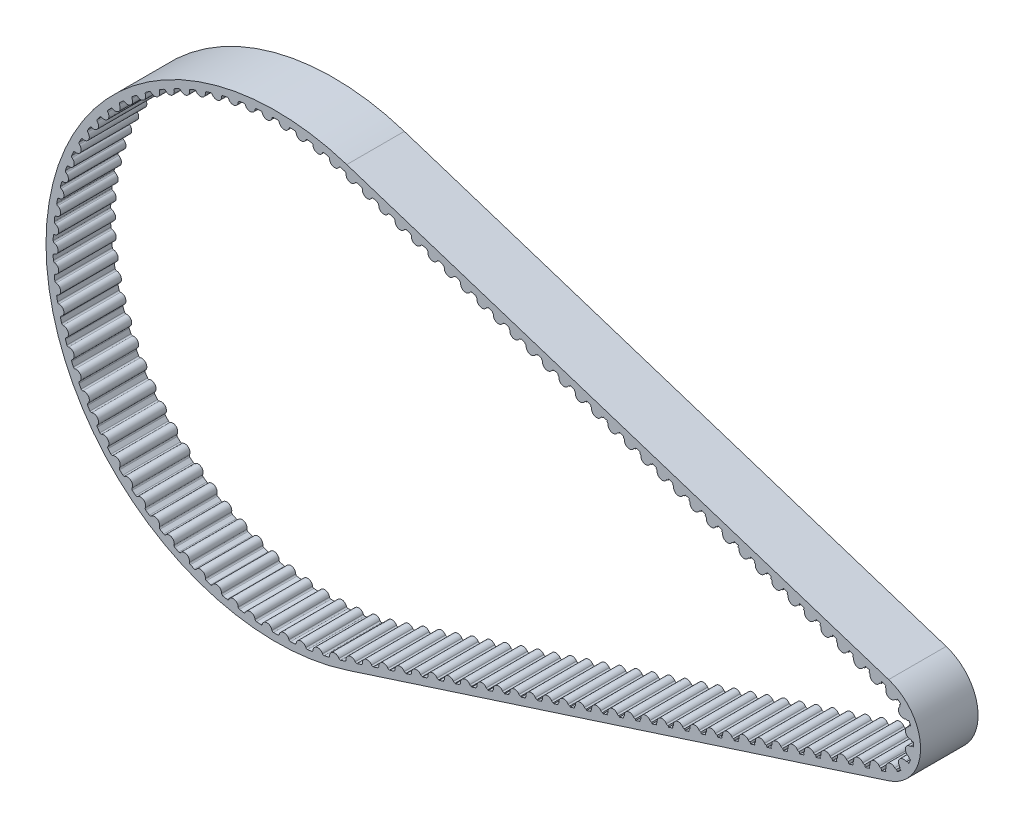
from build123d import *

# Parameters (mm, degrees)
BOSS_EXTRUDE1_DEPTH = 5
BOSS_EXTRUDE2_DEPTH = 10
CRVPATTERN1_START   = -5
CRVPATTERN1_DEPTH   = 10


# Read off the part's stored shape, not the designer's step: CrvPattern1
with BuildPart() as part:
    # Sketch1 → Boss-Extrude1 (new, symmetric)
    with BuildSketch(Plane.XY):
        with BuildLine():
            Line((12.298331989, 38.063635028), (106.512971248, 7.622955598))
            ThreePointArc((106.512971248, 7.622955598), (112.060972439, 0), (106.512971248, -7.622955598))
            Line((106.512971248, -7.622955598), (12.298331989, -38.063635028))
            ThreePointArc((12.298331989, -38.063635028), (-40.001116001, 0), (12.298331989, 38.063635028))
        make_face()
        with BuildLine():
            Line((11.920168831, 36.893210906), (106.13480809, 6.452531476))
            ThreePointArc((106.13480809, 6.452531476), (110.830972439, 0), (106.13480809, -6.452531476))
            Line((106.13480809, -6.452531476), (11.920168831, -36.893210906))
            ThreePointArc((11.920168831, -36.893210906), (-38.771116001, 0), (11.920168831, 36.893210906))
        make_face(mode=Mode.SUBTRACT)
    extrude(amount=BOSS_EXTRUDE1_DEPTH, both=True)

    # Sketch2 → Boss-Extrude2 (add)
    with BuildSketch(Plane.XY.offset(5)):
        with BuildLine():
            Line((-38.755415339, -1.103275955), (-39.255415339, -1.103275955))
            Line((-39.255415339, -1.103275955), (-39.255415339, 1.103275955))
            Line((-39.255415339, 1.103275955), (-38.755415339, 1.103275955))
            ThreePointArc((-38.755415339, 1.103275955), (-38.702819705, 0.938947145), (-38.558931953, 0.843728588))
            ThreePointArc((-38.558931953, 0.843728588), (-37.901116001, 0), (-38.558931953, -0.843728588))
            ThreePointArc((-38.558931953, -0.843728588), (-38.702819705, -0.938947145), (-38.755415339, -1.103275955))
        make_face()
    extrude(amount=-BOSS_EXTRUDE2_DEPTH)

    # CrvPattern1 outline → CrvPattern1 (add)
    with BuildSketch(Plane.XY.offset(CRVPATTERN1_START)):
        with BuildLine():
            ThreePointArc((-38.381581489, 3.789104595), (-38.517768642, 3.895044759), (-38.557647348, 4.062913599))
            ThreePointArc((-38.557647348, 4.062913599), (-38.657647934, 2.964066828), (-38.726339096, 1.862819413))
            ThreePointArc((-38.726339096, 1.862819413), (-38.661334387, 2.02264634), (-38.510588244, 2.106585955))
            ThreePointArc((-38.510588244, 2.106585955), (-37.790194087, 2.89755499), (-38.381581489, 3.789104595))
        make_face()
        with BuildLine():
            ThreePointArc((-37.979574926, 6.712302115), (-38.107264345, 6.828343792), (-38.134192704, 6.998770088))
            ThreePointArc((-38.134192704, 6.998770088), (-38.317907888, 5.9107843), (-38.470588808, 4.818011277))
            ThreePointArc((-38.470588808, 4.818011277), (-38.393555513, 4.972400817), (-38.236833329, 5.044570172))
            ThreePointArc((-38.236833329, 5.044570172), (-37.458077599, 5.778149936), (-37.979574926, 6.712302115))
        make_face()
        with BuildLine():
            ThreePointArc((-37.355265299, 9.596211007), (-37.473709589, 9.721674982), (-37.487529983, 9.893661189))
            ThreePointArc((-37.487529983, 9.893661189), (-37.753884438, 8.822904612), (-37.989661441, 7.745002228))
            ThreePointArc((-37.989661441, 7.745002228), (-37.901050453, 7.893050704), (-37.739269559, 7.953027376))
            ThreePointArc((-37.739269559, 7.953027376), (-36.906710489, 8.624924058), (-37.355265299, 9.596211007))
        make_face()
        with BuildLine():
            ThreePointArc((-36.512306833, 12.423951101), (-36.620812714, 12.558103002), (-36.621444248, 12.730642447))
            ThreePointArc((-36.621444248, 12.730642447), (-36.968878941, 11.683382461), (-37.286371971, 10.626659924))
            ThreePointArc((-37.286371971, 10.626659924), (-37.186701949, 10.767500776), (-37.020809286, 10.814933707))
            ThreePointArc((-37.020809286, 10.814933707), (-36.139320033, 11.421214544), (-36.512306833, 12.423951101))
        make_face()
        with BuildLine():
            ThreePointArc((-35.455633556, 15.178970992), (-35.553565917, 15.321025599), (-35.541004896, 15.493108369))
            ThreePointArc((-35.541004896, 15.493108369), (-35.967486213, 14.475474825), (-36.364836911, 13.446117371))
            ThreePointArc((-36.364836911, 13.446117371), (-36.254691247, 13.578926224), (-36.085657821, 13.613537779))
            ThreePointArc((-36.085657821, 13.613537779), (-35.160397942, 14.150654072), (-35.455633556, 15.178970992))
        make_face()
        with BuildLine():
            ThreePointArc((-34.191430416, 17.845144924), (-34.278216037, 17.994270759), (-34.252535983, 18.164889613))
            ThreePointArc((-34.252535983, 18.164889613), (-34.755567633, 17.182838951), (-35.230450214, 16.186871644))
            ThreePointArc((-35.230450214, 16.186871644), (-35.110473616, 16.310871138), (-34.939288819, 16.332458727))
            ThreePointArc((-34.939288819, 16.332458727), (-33.975674069, 16.797266612), (-34.191430416, 17.845144924))
        make_face()
        with BuildLine():
            ThreePointArc((-32.727097081, 20.406867175), (-32.802227986, 20.562191371), (-32.76357921, 20.73034764))
            ThreePointArc((-32.76357921, 20.73034764), (-33.340216834, 19.789628025), (-33.889851704, 18.832880486))
            ThreePointArc((-33.889851704, 18.832880486), (-33.760746421, 18.947344824), (-33.588412237, 18.955782091))
            ThreePointArc((-33.588412237, 18.955782091), (-32.592082872, 19.345560942), (-32.727097081, 20.406867175))
        make_face()
        with BuildLine():
            ThreePointArc((-31.071204625, 22.849143406), (-31.134241056, 23.009756815), (-31.082849778, 23.174466242))
            ThreePointArc((-31.082849778, 23.174466242), (-31.729718185, 22.280583919), (-32.350888206, 21.368656209))
            ThreePointArc((-32.350888206, 21.368656209), (-32.213409922, 21.472915405), (-32.040935061, 21.468152964))
            ThreePointArc((-32.040935061, 21.468152964), (-31.017722823, 21.780621318), (-31.071204625, 22.849143406))
        make_face()
        with BuildLine():
            ThreePointArc((-29.233445363, 25.157678419), (-29.284018353, 25.322640934), (-29.220185379, 25.482939438))
            ThreePointArc((-29.220185379, 25.482939438), (-29.933498302, 24.641126503), (-30.622567625, 23.779356341))
            ThreePointArc((-30.622567625, 23.779356341), (-30.477521031, 23.872800143), (-30.305915027, 23.85486587))
            ThreePointArc((-30.305915027, 23.85486587), (-29.261809009, 24.088194777), (-29.233445363, 25.157678419))
        make_face()
        with BuildLine():
            ThreePointArc((-27.224576117, 27.318959836), (-27.262389651, 27.487305894), (-27.186488608, 27.64225521))
            ThreePointArc((-27.186488608, 27.64225521), (-27.962070865, 26.857438985), (-28.715006211, 26.050870508))
            ThreePointArc((-28.715006211, 26.050870508), (-28.563240297, 26.132951968), (-28.3935076, 26.101950836))
            ThreePointArc((-28.3935076, 26.101950836), (-27.334619191, 26.254774571), (-27.224576117, 27.318959836))
        make_face()
        with BuildLine():
            ThreePointArc((-25.056355252, 29.320337186), (-25.081188, 29.49108142), (-24.993663155, 29.639774595))
            ThreePointArc((-24.993663155, 29.639774595), (-25.826975086, 28.916548787), (-26.639369354, 28.169903023))
            ThreePointArc((-26.639369354, 28.169903023), (-26.481772441, 28.240141699), (-26.314906534, 28.196255165))
            ThreePointArc((-26.314906534, 28.196255165), (-25.247433649, 28.267679216), (-25.056355252, 29.320337186))
        make_face()
        with BuildLine():
            ThreePointArc((-22.741473859, 31.150095954), (-22.753180468, 31.322238959), (-22.654544124, 31.463805658))
            ThreePointArc((-22.654544124, 31.463805658), (-23.540708166, 30.806403473), (-24.407806228, 30.124050708))
            ThreePointArc((-24.407806228, 30.124050708), (-24.245300766, 30.182035478), (-24.082278354, 30.125520419))
            ThreePointArc((-24.082278354, 30.125520419), (-23.012469152, 30.115126724), (-22.741473859, 31.150095954))
        make_face()
        with BuildLine():
            ThreePointArc((-20.293481463, 32.797526147), (-20.291993412, 32.970060331), (-20.182822909, 33.103671932))
            ThreePointArc((-20.182822909, 33.103671932), (-21.116652144, 32.515941292), (-22.033378678, 31.901875492))
            ThreePointArc((-22.033378678, 31.901875492), (-21.866915848, 31.947266959), (-21.708691137, 31.878454171))
            ThreePointArc((-21.708691137, 31.878454171), (-20.642807456, 31.786303567), (-20.293481463, 32.797526147))
        make_face()
        with BuildLine():
            ThreePointArc((-17.726706718, 34.252984982), (-17.712032717, 34.424900463), (-17.592967055, 34.549774907))
            ThreePointArc((-17.592967055, 34.549774907), (-18.568995567, 34.035155935), (-19.529984765, 33.492971367))
            ThreePointArc((-19.529984765, 33.492971367), (-19.360538913, 33.525503841), (-19.208038029, 33.444796102))
            ThreePointArc((-19.208038029, 33.444796102), (-18.152318726, 33.271427967), (-17.726706718, 34.252984982))
        make_face()
        with BuildLine():
            ThreePointArc((-15.056173539, 35.507953329), (-15.028399478, 35.678243847), (-14.900135575, 35.793650216))
            ThreePointArc((-14.900135575, 35.793650216), (-15.912650449, 35.355155092), (-16.912277424, 34.888025284))
            ThreePointArc((-16.912277424, 34.888025284), (-16.740840354, 34.907508348), (-16.594955919, 34.815378058))
            ThreePointArc((-16.594955919, 34.815378058), (-15.555580359, 34.561807154), (-15.056173539, 35.507953329))
        make_face()
        with BuildLine():
            ThreePointArc((-12.297513162, 36.555085574), (-12.256801609, 36.722754379), (-12.120090224, 36.828017173))
            ThreePointArc((-12.120090224, 36.828017173), (-13.16316498, 36.468212509), (-14.195578687, 36.078871679))
            ThreePointArc((-14.195578687, 36.078871679), (-14.023153859, 36.085191293), (-13.884739768, 35.982177711))
            ThreePointArc((-13.884739768, 35.982177711), (-12.867791653, 35.649888248), (-12.297513162, 36.555085574))
        make_face()
        with BuildLine():
            ThreePointArc((-9.466872652, 37.388252613), (-9.4134619, 37.552318302), (-9.269103235, 37.646821395))
            ThreePointArc((-9.269103235, 37.646821395), (-10.336632521, 37.367813209), (-11.39579001, 37.058540257))
            ThreePointArc((-11.39579001, 37.058540257), (-11.223386666, 37.051659431), (-11.093253087, 36.938365519))
            ThreePointArc((-11.093253087, 36.938365519), (-10.104684844, 36.529302461), (-9.466872652, 37.388252613))
        make_face()
        with BuildLine():
            ThreePointArc((-6.580820389, 38.002577732), (-6.515023065, 38.162079992), (-6.363862084, 38.245270234))
            ThreePointArc((-6.363862084, 38.245270234), (-7.449597408, 38.048691625), (-8.529299189, 37.821296795))
            ThreePointArc((-8.529299189, 37.821296795), (-8.357926445, 37.801255804), (-8.236835081, 37.678344697))
            ThreePointArc((-8.236835081, 37.678344697), (-7.282433024, 37.194902384), (-6.580820389, 38.002577732))
        make_face()
        with BuildLine():
            ThreePointArc((-3.656249093, 38.394465146), (-3.578450323, 38.548470373), (-3.421371805, 38.619860835))
            ThreePointArc((-3.421371805, 38.619860835), (-4.518958112, 38.506862421), (-5.612884446, 38.362676707))
            ThreePointArc((-5.612884446, 38.362676707), (-5.443545386, 38.329592855), (-5.332205011, 38.19778398))
            ThreePointArc((-5.332205011, 38.19778398), (-4.417555472, 37.642792109), (-3.656249093, 38.394465146))
        make_face()
        with BuildLine():
            ThreePointArc((-0.710276942, 38.561621049), (-0.620932099, 38.709227817), (-0.458855461, 38.768400632))
            ThreePointArc((-0.458855461, 38.768400632), (-1.56186833, 38.739643819), (-2.663616218, 38.679511172))
            ThreePointArc((-2.663616218, 38.679511172), (-2.497302021, 38.633578108), (-2.396364336, 38.493642972))
            ThreePointArc((-2.396364336, 38.493642972), (-1.526820966, 37.870350036), (-0.710276942, 38.561621049))
        make_face()
        with BuildLine():
            ThreePointArc((2.239852622, 38.50306704), (2.340220581, 38.643411372), (2.506346668, 38.69002019))
            ThreePointArc((2.506346668, 38.69002019), (1.404363422, 38.745673298), (0.30124276, 38.769945689))
            ThreePointArc((0.30124276, 38.769945689), (0.463558619, 38.711432268), (0.553502803, 38.564189942))
            ThreePointArc((0.553502803, 38.564189942), (1.37285037, 37.876244217), (2.239852622, 38.50306704))
        make_face()
        with BuildLine():
            ThreePointArc((5.17687182, 38.219145849), (5.28767542, 38.351406278), (5.456878582, 38.385178286))
            ThreePointArc((5.456878582, 38.385178286), (4.362375116, 38.524915565), (3.264338495, 38.633450921))
            ThreePointArc((3.264338495, 38.633450921), (3.421705945, 38.562699636), (3.500130165, 38.409011964))
            ThreePointArc((3.500130165, 38.409011964), (4.264486101, 37.660440151), (5.17687182, 38.219145849))
        make_face()
        with BuildLine():
            ThreePointArc((8.083589613, 37.711519331), (8.204180295, 37.834921706), (8.375470148, 37.85565923))
            ThreePointArc((8.375470148, 37.85565923), (7.29485284, 38.078662765), (6.208327318, 38.270825805))
            ThreePointArc((6.208327318, 38.270825805), (6.359825251, 38.18825078), (6.426270471, 38.02901733))
            ThreePointArc((6.426270471, 38.02901733), (7.131160828, 37.22420099), (8.083589613, 37.711519331))
        make_face()
        with BuildLine():
            ThreePointArc((10.942992324, 36.983158738), (11.072664242, 37.096980759), (11.245038188, 37.104562416))
            ThreePointArc((11.245038188, 37.104562416), (10.184632135, 37.409526917), (9.115977392, 37.684192868))
            ThreePointArc((9.115977392, 37.684192868), (9.260719057, 37.590277431), (9.314796359, 37.426430234))
            ThreePointArc((9.314796359, 37.426430234), (9.956095253, 36.570080139), (10.942992324, 36.983158738))
        make_face()
        with BuildLine():
            Line((14.071899965, 36.172361246), (14.079489261, 36.195536092))
            Line((14.079489261, 36.195536092), (11.979796702, 36.873945186))
            Line((11.979796702, 36.873945186), (11.974927814, 36.859077439))
            ThreePointArc((11.974927814, 36.859077439), (12.114727229, 36.757951862), (12.160436832, 36.59157611))
            ThreePointArc((12.160436832, 36.59157611), (12.757541517, 35.703845435), (13.764093055, 36.066410958))
            ThreePointArc((13.764093055, 36.066410958), (13.899363252, 36.173519467), (14.071899965, 36.172361246))
        make_face()
        with BuildLine():
            Line((16.919227329, 35.239918816), (16.93051047, 35.274373273))
            Line((16.93051047, 35.274373273), (14.830817911, 35.952782367))
            Line((14.830817911, 35.952782367), (14.822255178, 35.926635009))
            ThreePointArc((14.822255178, 35.926635009), (14.962054592, 35.825509432), (15.007764196, 35.65913368))
            ThreePointArc((15.007764196, 35.65913368), (15.604868881, 34.771403005), (16.611420419, 35.133968528))
            ThreePointArc((16.611420419, 35.133968528), (16.746690616, 35.241077037), (16.919227329, 35.239918816))
        make_face()
        with BuildLine():
            Line((19.766554693, 34.307476386), (19.78153168, 34.353210454))
            Line((19.78153168, 34.353210454), (17.681839121, 35.031619548))
            Line((17.681839121, 35.031619548), (17.669582542, 34.994192579))
            ThreePointArc((17.669582542, 34.994192579), (17.809381956, 34.893067002), (17.85509156, 34.72669125))
            ThreePointArc((17.85509156, 34.72669125), (18.452196245, 33.838960575), (19.458747783, 34.201526098))
            ThreePointArc((19.458747783, 34.201526098), (19.59401798, 34.308634606), (19.766554693, 34.307476386))
        make_face()
        with BuildLine():
            Line((22.613882057, 33.375033955), (22.63255289, 33.432047635))
            Line((22.63255289, 33.432047635), (20.532860331, 34.110456729))
            Line((20.532860331, 34.110456729), (20.516909905, 34.061750149))
            ThreePointArc((20.516909905, 34.061750149), (20.65670932, 33.960624571), (20.702418924, 33.794248819))
            ThreePointArc((20.702418924, 33.794248819), (21.29952361, 32.906518145), (22.306075147, 33.269083668))
            ThreePointArc((22.306075147, 33.269083668), (22.441345344, 33.376192176), (22.613882057, 33.375033955))
        make_face()
        with BuildLine():
            Line((25.461209421, 32.442591525), (25.483574099, 32.510884816))
            Line((25.483574099, 32.510884816), (23.38388154, 33.18929391))
            Line((23.38388154, 33.18929391), (23.364237269, 33.129307719))
            ThreePointArc((23.364237269, 33.129307719), (23.504036684, 33.028182141), (23.549746287, 32.861806389))
            ThreePointArc((23.549746287, 32.861806389), (24.146850973, 31.974075714), (25.153402511, 32.336641238))
            ThreePointArc((25.153402511, 32.336641238), (25.288672708, 32.443749746), (25.461209421, 32.442591525))
        make_face()
        with BuildLine():
            Line((28.308536784, 31.510149095), (28.334595309, 31.589721997))
            Line((28.334595309, 31.589721997), (26.23490275, 32.268131091))
            Line((26.23490275, 32.268131091), (26.211564633, 32.196865288))
            ThreePointArc((26.211564633, 32.196865288), (26.351364048, 32.095739711), (26.397073651, 31.929363959))
            ThreePointArc((26.397073651, 31.929363959), (26.994178337, 31.041633284), (28.000729875, 31.404198808))
            ThreePointArc((28.000729875, 31.404198808), (28.136000072, 31.511307316), (28.308536784, 31.510149095))
        make_face()
        with BuildLine():
            Line((31.155864148, 30.577706665), (31.185616518, 30.668559178))
            Line((31.185616518, 30.668559178), (29.085923959, 31.346968272))
            Line((29.085923959, 31.346968272), (29.058891997, 31.264422858))
            ThreePointArc((29.058891997, 31.264422858), (29.198691412, 31.163297281), (29.244401015, 30.996921529))
            ThreePointArc((29.244401015, 30.996921529), (29.841505701, 30.109190854), (30.848057239, 30.471756377))
            ThreePointArc((30.848057239, 30.471756377), (30.983327435, 30.578864886), (31.155864148, 30.577706665))
        make_face()
        with BuildLine():
            Line((34.003191512, 29.645264235), (34.036637728, 29.747396359))
            Line((34.036637728, 29.747396359), (31.936945169, 30.425805453))
            Line((31.936945169, 30.425805453), (31.906219361, 30.331980428))
            ThreePointArc((31.906219361, 30.331980428), (32.046018776, 30.230854851), (32.091728379, 30.064479099))
            ThreePointArc((32.091728379, 30.064479099), (32.688833064, 29.176748424), (33.695384602, 29.539313947))
            ThreePointArc((33.695384602, 29.539313947), (33.830654799, 29.646422456), (34.003191512, 29.645264235))
        make_face()
        with BuildLine():
            Line((36.850518876, 28.712821805), (36.887658938, 28.82623354))
            Line((36.887658938, 28.82623354), (34.787966379, 29.504642634))
            Line((34.787966379, 29.504642634), (34.753546725, 29.399537998))
            ThreePointArc((34.753546725, 29.399537998), (34.89334614, 29.29841242), (34.939055743, 29.132036668))
            ThreePointArc((34.939055743, 29.132036668), (35.536160429, 28.244305994), (36.542711966, 28.606871517))
            ThreePointArc((36.542711966, 28.606871517), (36.677982163, 28.713980025), (36.850518876, 28.712821805))
        make_face()
        with BuildLine():
            Line((39.69784624, 27.780379374), (39.738680147, 27.905070721))
            Line((39.738680147, 27.905070721), (37.638987588, 28.583479815))
            Line((37.638987588, 28.583479815), (37.600874089, 28.467095568))
            ThreePointArc((37.600874089, 28.467095568), (37.740673503, 28.36596999), (37.786383107, 28.199594238))
            ThreePointArc((37.786383107, 28.199594238), (38.383487793, 27.311863564), (39.39003933, 27.674429087))
            ThreePointArc((39.39003933, 27.674429087), (39.525309527, 27.781537595), (39.69784624, 27.780379374))
        make_face()
        with BuildLine():
            Line((42.545173604, 26.847936944), (42.589701357, 26.983907902))
            Line((42.589701357, 26.983907902), (40.490008798, 27.662316996))
            Line((40.490008798, 27.662316996), (40.448201453, 27.534653138))
            ThreePointArc((40.448201453, 27.534653138), (40.588000867, 27.43352756), (40.633710471, 27.267151808))
            ThreePointArc((40.633710471, 27.267151808), (41.230815156, 26.379421133), (42.237366694, 26.741986657))
            ThreePointArc((42.237366694, 26.741986657), (42.372636891, 26.849095165), (42.545173604, 26.847936944))
        make_face()
        with BuildLine():
            Line((45.392500968, 25.915494514), (45.440722566, 26.062745083))
            Line((45.440722566, 26.062745083), (43.341030007, 26.741154177))
            Line((43.341030007, 26.741154177), (43.295528816, 26.602210707))
            ThreePointArc((43.295528816, 26.602210707), (43.435328231, 26.50108513), (43.481037834, 26.334709378))
            ThreePointArc((43.481037834, 26.334709378), (44.07814252, 25.446978703), (45.084694058, 25.809544227))
            ThreePointArc((45.084694058, 25.809544227), (45.219964255, 25.916652735), (45.392500968, 25.915494514))
        make_face()
        with BuildLine():
            Line((48.239828331, 24.983052084), (48.291743776, 25.141582264))
            Line((48.291743776, 25.141582264), (46.192051217, 25.819991358))
            Line((46.192051217, 25.819991358), (46.14285618, 25.669768277))
            ThreePointArc((46.14285618, 25.669768277), (46.282655595, 25.5686427), (46.328365198, 25.402266948))
            ThreePointArc((46.328365198, 25.402266948), (46.925469884, 24.514536273), (47.932021422, 24.877101796))
            ThreePointArc((47.932021422, 24.877101796), (48.067291618, 24.984210305), (48.239828331, 24.983052084))
        make_face()
        with BuildLine():
            Line((51.087155695, 24.050609654), (51.142764986, 24.220419445))
            Line((51.142764986, 24.220419445), (49.043072427, 24.898828539))
            Line((49.043072427, 24.898828539), (48.990183544, 24.737325847))
            ThreePointArc((48.990183544, 24.737325847), (49.129982959, 24.63620027), (49.175692562, 24.469824518))
            ThreePointArc((49.175692562, 24.469824518), (49.772797248, 23.582093843), (50.779348786, 23.944659366))
            ThreePointArc((50.779348786, 23.944659366), (50.914618982, 24.051767875), (51.087155695, 24.050609654))
        make_face()
        with BuildLine():
            Line((53.934483059, 23.118167223), (53.993786195, 23.299256626))
            Line((53.993786195, 23.299256626), (51.894093636, 23.97766572))
            Line((51.894093636, 23.97766572), (51.837510908, 23.804883417))
            ThreePointArc((51.837510908, 23.804883417), (51.977310323, 23.70375784), (52.023019926, 23.537382087))
            ThreePointArc((52.023019926, 23.537382087), (52.620124612, 22.649651413), (53.626676149, 23.012216936))
            ThreePointArc((53.626676149, 23.012216936), (53.761946346, 23.119325444), (53.934483059, 23.118167223))
        make_face()
        with BuildLine():
            Line((56.781810423, 22.185724793), (56.844807405, 22.378093807))
            Line((56.844807405, 22.378093807), (54.745114846, 23.056502901))
            Line((54.745114846, 23.056502901), (54.684838272, 22.872440987))
            ThreePointArc((54.684838272, 22.872440987), (54.824637686, 22.771315409), (54.87034729, 22.604939657))
            ThreePointArc((54.87034729, 22.604939657), (55.467451976, 21.717208983), (56.474003513, 22.079774506))
            ThreePointArc((56.474003513, 22.079774506), (56.60927371, 22.186883014), (56.781810423, 22.185724793))
        make_face()
        with BuildLine():
            Line((59.629137787, 21.253282363), (59.695828614, 21.456930988))
            Line((59.695828614, 21.456930988), (57.596136055, 22.135340082))
            Line((57.596136055, 22.135340082), (57.532165636, 21.939998557))
            ThreePointArc((57.532165636, 21.939998557), (57.67196505, 21.838872979), (57.717674654, 21.672497227))
            ThreePointArc((57.717674654, 21.672497227), (58.31477934, 20.784766552), (59.321330877, 21.147332076))
            ThreePointArc((59.321330877, 21.147332076), (59.456601074, 21.254440584), (59.629137787, 21.253282363))
        make_face()
        with BuildLine():
            Line((62.476465151, 20.320839933), (62.546849824, 20.535768169))
            Line((62.546849824, 20.535768169), (60.447157265, 21.214177263))
            Line((60.447157265, 21.214177263), (60.379493, 21.007556126))
            ThreePointArc((60.379493, 21.007556126), (60.519292414, 20.906430549), (60.565002018, 20.740054797))
            ThreePointArc((60.565002018, 20.740054797), (61.162106703, 19.852324122), (62.168658241, 20.214889646))
            ThreePointArc((62.168658241, 20.214889646), (62.303928438, 20.321998154), (62.476465151, 20.320839933))
        make_face()
        with BuildLine():
            Line((65.323792515, 19.388397503), (65.397871034, 19.61460535))
            Line((65.397871034, 19.61460535), (63.298178475, 20.293014444))
            Line((63.298178475, 20.293014444), (63.226820363, 20.075113696))
            ThreePointArc((63.226820363, 20.075113696), (63.366619778, 19.973988119), (63.412329382, 19.807612367))
            ThreePointArc((63.412329382, 19.807612367), (64.009434067, 18.919881692), (65.015985605, 19.282447215))
            ThreePointArc((65.015985605, 19.282447215), (65.151255802, 19.389555724), (65.323792515, 19.388397503))
        make_face()
        with BuildLine():
            Line((68.171119878, 18.455955073), (68.248892243, 18.693442531))
            Line((68.248892243, 18.693442531), (66.149199684, 19.371851625))
            Line((66.149199684, 19.371851625), (66.074147727, 19.142671266))
            ThreePointArc((66.074147727, 19.142671266), (66.213947142, 19.041545689), (66.259656745, 18.875169937))
            ThreePointArc((66.259656745, 18.875169937), (66.856761431, 17.987439262), (67.863312969, 18.350004785))
            ThreePointArc((67.863312969, 18.350004785), (67.998583165, 18.457113294), (68.171119878, 18.455955073))
        make_face()
        with BuildLine():
            Line((71.018447242, 17.523512642), (71.099913453, 17.772279712))
            Line((71.099913453, 17.772279712), (69.000220894, 18.450688806))
            Line((69.000220894, 18.450688806), (68.921475091, 18.210228836))
            ThreePointArc((68.921475091, 18.210228836), (69.061274506, 18.109103258), (69.106984109, 17.942727506))
            ThreePointArc((69.106984109, 17.942727506), (69.704088795, 17.054996832), (70.710640333, 17.417562355))
            ThreePointArc((70.710640333, 17.417562355), (70.84591053, 17.524670863), (71.018447242, 17.523512642))
        make_face()
        with BuildLine():
            Line((73.865774606, 16.591070212), (73.950934662, 16.851116893))
            Line((73.950934662, 16.851116893), (71.851242103, 17.529525987))
            Line((71.851242103, 17.529525987), (71.768802455, 17.277786406))
            ThreePointArc((71.768802455, 17.277786406), (71.90860187, 17.176660828), (71.954311473, 17.010285076))
            ThreePointArc((71.954311473, 17.010285076), (72.551416159, 16.122554402), (73.557967697, 16.485119925))
            ThreePointArc((73.557967697, 16.485119925), (73.693237894, 16.592228433), (73.865774606, 16.591070212))
        make_face()
        with BuildLine():
            Line((76.71310197, 15.658627782), (76.801955872, 15.929954074))
            Line((76.801955872, 15.929954074), (74.702263313, 16.608363168))
            Line((74.702263313, 16.608363168), (74.616129819, 16.345343975))
            ThreePointArc((74.616129819, 16.345343975), (74.755929234, 16.244218398), (74.801638837, 16.077842646))
            ThreePointArc((74.801638837, 16.077842646), (75.398743523, 15.190111971), (76.40529506, 15.552677495))
            ThreePointArc((76.40529506, 15.552677495), (76.540565257, 15.659786003), (76.71310197, 15.658627782))
        make_face()
        with BuildLine():
            Line((79.560429334, 14.726185352), (79.652977082, 15.008791255))
            Line((79.652977082, 15.008791255), (77.553284523, 15.687200349))
            Line((77.553284523, 15.687200349), (77.463457183, 15.412901545))
            ThreePointArc((77.463457183, 15.412901545), (77.603256597, 15.311775968), (77.648966201, 15.145400216))
            ThreePointArc((77.648966201, 15.145400216), (78.246070886, 14.257669541), (79.252622424, 14.620235064))
            ThreePointArc((79.252622424, 14.620235064), (79.387892621, 14.727343573), (79.560429334, 14.726185352))
        make_face()
        with BuildLine():
            Line((82.407756698, 13.793742922), (82.503998291, 14.087628436))
            Line((82.503998291, 14.087628436), (80.404305732, 14.76603753))
            Line((80.404305732, 14.76603753), (80.310784547, 14.480459115))
            ThreePointArc((80.310784547, 14.480459115), (80.450583961, 14.379333538), (80.496293565, 14.212957786))
            ThreePointArc((80.496293565, 14.212957786), (81.09339825, 13.325227111), (82.099949788, 13.687792634))
            ThreePointArc((82.099949788, 13.687792634), (82.235219985, 13.794901143), (82.407756698, 13.793742922))
        make_face()
        with BuildLine():
            Line((85.255084062, 12.861300492), (85.355019501, 13.166465617))
            Line((85.355019501, 13.166465617), (83.255326942, 13.844874711))
            Line((83.255326942, 13.844874711), (83.15811191, 13.548016685))
            ThreePointArc((83.15811191, 13.548016685), (83.297911325, 13.446891108), (83.343620929, 13.280515356))
            ThreePointArc((83.343620929, 13.280515356), (83.940725614, 12.392784681), (84.947277152, 12.755350204))
            ThreePointArc((84.947277152, 12.755350204), (85.082547349, 12.862458712), (85.255084062, 12.861300492))
        make_face()
        with BuildLine():
            Line((88.102411425, 11.928858061), (88.20604071, 12.245302798))
            Line((88.20604071, 12.245302798), (86.106348151, 12.923711892))
            Line((86.106348151, 12.923711892), (86.005439274, 12.615574255))
            ThreePointArc((86.005439274, 12.615574255), (86.145238689, 12.514448677), (86.190948292, 12.348072925))
            ThreePointArc((86.190948292, 12.348072925), (86.788052978, 11.460342251), (87.794604516, 11.822907774))
            ThreePointArc((87.794604516, 11.822907774), (87.929874713, 11.930016282), (88.102411425, 11.928858061))
        make_face()
        with BuildLine():
            Line((90.949738789, 10.996415631), (91.05706192, 11.324139979))
            Line((91.05706192, 11.324139979), (88.957369361, 12.002549073))
            Line((88.957369361, 12.002549073), (88.852766638, 11.683131825))
            ThreePointArc((88.852766638, 11.683131825), (88.992566053, 11.582006247), (89.038275656, 11.415630495))
            ThreePointArc((89.038275656, 11.415630495), (89.635380342, 10.52789982), (90.64193188, 10.890465344))
            ThreePointArc((90.64193188, 10.890465344), (90.777202077, 10.997573852), (90.949738789, 10.996415631))
        make_face()
        with BuildLine():
            Line((93.797066153, 10.063973201), (93.90808313, 10.40297716))
            Line((93.90808313, 10.40297716), (91.808390571, 11.081386254))
            Line((91.808390571, 11.081386254), (91.700094002, 10.750689394))
            ThreePointArc((91.700094002, 10.750689394), (91.839893417, 10.649563817), (91.88560302, 10.483188065))
            ThreePointArc((91.88560302, 10.483188065), (92.482707706, 9.59545739), (93.489259244, 9.958022914))
            ThreePointArc((93.489259244, 9.958022914), (93.624529441, 10.065131422), (93.797066153, 10.063973201))
        make_face()
        with BuildLine():
            Line((96.644393517, 9.131530771), (96.759104339, 9.481814341))
            Line((96.759104339, 9.481814341), (94.65941178, 10.160223435))
            Line((94.65941178, 10.160223435), (94.547421366, 9.818246964))
            ThreePointArc((94.547421366, 9.818246964), (94.687220781, 9.717121387), (94.732930384, 9.550745635))
            ThreePointArc((94.732930384, 9.550745635), (95.330035069, 8.66301496), (96.336586607, 9.025580483))
            ThreePointArc((96.336586607, 9.025580483), (96.471856804, 9.132688992), (96.644393517, 9.131530771))
        make_face()
        with BuildLine():
            Line((99.491720881, 8.199088341), (99.610125549, 8.560651522))
            Line((99.610125549, 8.560651522), (97.51043299, 9.239060616))
            Line((97.51043299, 9.239060616), (97.39474873, 8.885804534))
            ThreePointArc((97.39474873, 8.885804534), (97.534548144, 8.784678957), (97.580257748, 8.618303205))
            ThreePointArc((97.580257748, 8.618303205), (98.177362433, 7.73057253), (99.183913971, 8.093138053))
            ThreePointArc((99.183913971, 8.093138053), (99.319184168, 8.200246562), (99.491720881, 8.199088341))
        make_face()
        with BuildLine():
            Line((102.339048245, 7.266645911), (102.461146759, 7.639488703))
            Line((102.461146759, 7.639488703), (100.3614542, 8.317897797))
            Line((100.3614542, 8.317897797), (100.242076094, 7.953362104))
            ThreePointArc((100.242076094, 7.953362104), (100.381875509, 7.852236526), (100.427585112, 7.685860774))
            ThreePointArc((100.427585112, 7.685860774), (101.024689798, 6.7981301), (102.031241335, 7.160695623))
            ThreePointArc((102.031241335, 7.160695623), (102.166511532, 7.267804131), (102.339048245, 7.266645911))
        make_face()
        with BuildLine():
            Line((105.186375609, 6.33420348), (105.312167968, 6.718325884))
            Line((105.312167968, 6.718325884), (103.212475409, 7.396734978))
            Line((103.212475409, 7.396734978), (103.089403457, 7.020919674))
            ThreePointArc((103.089403457, 7.020919674), (103.229202872, 6.919794096), (103.274912476, 6.753418344))
            ThreePointArc((103.274912476, 6.753418344), (103.872017162, 5.86568767), (104.878568699, 6.228253193))
            ThreePointArc((104.878568699, 6.228253193), (105.013838896, 6.335361701), (105.186375609, 6.33420348))
        make_face()
        with BuildLine():
            Line((107.890949372, 5.204158934), (108.033072459, 5.487870352))
            ThreePointArc((108.033072459, 5.487870352), (107.122041074, 6.045175834), (106.13480809, 6.452531476))
            Line((106.13480809, 6.452531476), (106.06042124, 6.476565812))
            Line((106.06042124, 6.476565812), (105.918093616, 6.192446086))
            ThreePointArc((105.918093616, 6.192446086), (106.041461413, 6.071820031), (106.062149828, 5.90052424))
            ThreePointArc((106.062149828, 5.90052424), (106.521891447, 4.934482108), (107.57088823, 5.144733162))
            ThreePointArc((107.57088823, 5.144733162), (107.720467713, 5.230734539), (107.890949372, 5.204158934))
        make_face()
        with BuildLine():
            Line((109.7496028, 3.05788983), (109.999533735, 3.253403688))
            ThreePointArc((109.999533735, 3.253403688), (109.390923568, 4.178052496), (108.639980987, 4.991358709))
            Line((108.639980987, 4.991358709), (108.390050051, 4.795844852))
            ThreePointArc((108.390050051, 4.795844852), (108.449874086, 4.634007453), (108.39521152, 4.470354581))
            ThreePointArc((108.39521152, 4.470354581), (108.396951331, 3.400496306), (109.434927391, 3.141256155))
            ThreePointArc((109.434927391, 3.141256155), (109.606926559, 3.154914306), (109.7496028, 3.05788983))
        make_face()
        with BuildLine():
            Line((110.510046967, 0.322421261), (110.819628629, 0.392065611))
            ThreePointArc((110.819628629, 0.392065611), (110.665635601, 1.488271752), (110.335339848, 2.544816342))
            Line((110.335339848, 2.544816342), (110.025758186, 2.475171992))
            ThreePointArc((110.025758186, 2.475171992), (110.010511461, 2.303306358), (109.891030391, 2.178829322))
            ThreePointArc((109.891030391, 2.178829322), (109.434433164, 1.211297033), (110.26138949, 0.532516515))
            ThreePointArc((110.26138949, 0.532516515), (110.422667246, 0.471199764), (110.510046967, 0.322421261))
        make_face()
        with BuildLine():
            Line((110.025758186, -2.475171992), (110.335339848, -2.544816342))
            ThreePointArc((110.335339848, -2.544816342), (110.665635601, -1.488271752), (110.819628629, -0.392065611))
            Line((110.819628629, -0.392065611), (110.510046967, -0.322421261))
            ThreePointArc((110.510046967, -0.322421261), (110.422667246, -0.471199764), (110.26138949, -0.532516515))
            ThreePointArc((110.26138949, -0.532516515), (109.434433164, -1.211297033), (109.891030391, -2.178829322))
            ThreePointArc((109.891030391, -2.178829322), (110.010511461, -2.303306358), (110.025758186, -2.475171992))
        make_face()
        with BuildLine():
            Line((108.390050051, -4.795844852), (108.639980987, -4.991358709))
            ThreePointArc((108.639980987, -4.991358709), (109.390923568, -4.178052496), (109.999533735, -3.253403688))
            Line((109.999533735, -3.253403688), (109.7496028, -3.05788983))
            ThreePointArc((109.7496028, -3.05788983), (109.606926559, -3.154914306), (109.434927391, -3.141256155))
            ThreePointArc((109.434927391, -3.141256155), (108.396951331, -3.400496306), (108.39521152, -4.470354581))
            ThreePointArc((108.39521152, -4.470354581), (108.449874086, -4.634007453), (108.390050051, -4.795844852))
        make_face()
        with BuildLine():
            Line((105.918093616, -6.192446086), (106.06042124, -6.476565811))
            Line((106.06042124, -6.476565811), (106.13480809, -6.452531476))
            ThreePointArc((106.13480809, -6.452531476), (107.122041074, -6.045175834), (108.033072459, -5.487870352))
            Line((108.033072459, -5.487870352), (107.890949372, -5.204158934))
            ThreePointArc((107.890949372, -5.204158934), (107.720467713, -5.230734539), (107.57088823, -5.144733162))
            ThreePointArc((107.57088823, -5.144733162), (106.521891447, -4.934482108), (106.062149828, -5.90052424))
            ThreePointArc((106.062149828, -5.90052424), (106.041461413, -6.071820031), (105.918093616, -6.192446086))
        make_face()
        with BuildLine():
            Line((103.089403457, -7.020919674), (103.212475409, -7.396734978))
            Line((103.212475409, -7.396734978), (105.312167968, -6.718325884))
            Line((105.312167968, -6.718325884), (105.186375609, -6.33420348))
            ThreePointArc((105.186375609, -6.33420348), (105.013838896, -6.335361701), (104.878568699, -6.228253193))
            ThreePointArc((104.878568699, -6.228253193), (103.872017162, -5.86568767), (103.274912476, -6.753418344))
            ThreePointArc((103.274912476, -6.753418344), (103.229202872, -6.919794096), (103.089403457, -7.020919674))
        make_face()
        with BuildLine():
            Line((100.242076094, -7.953362104), (100.3614542, -8.317897797))
            Line((100.3614542, -8.317897797), (102.461146759, -7.639488703))
            Line((102.461146759, -7.639488703), (102.339048245, -7.266645911))
            ThreePointArc((102.339048245, -7.266645911), (102.166511532, -7.267804131), (102.031241335, -7.160695623))
            ThreePointArc((102.031241335, -7.160695623), (101.024689798, -6.7981301), (100.427585112, -7.685860774))
            ThreePointArc((100.427585112, -7.685860774), (100.381875509, -7.852236526), (100.242076094, -7.953362104))
        make_face()
        with BuildLine():
            Line((97.39474873, -8.885804534), (97.51043299, -9.239060616))
            Line((97.51043299, -9.239060616), (99.610125549, -8.560651522))
            Line((99.610125549, -8.560651522), (99.491720881, -8.199088341))
            ThreePointArc((99.491720881, -8.199088341), (99.319184168, -8.200246562), (99.183913971, -8.093138053))
            ThreePointArc((99.183913971, -8.093138053), (98.177362433, -7.73057253), (97.580257748, -8.618303205))
            ThreePointArc((97.580257748, -8.618303205), (97.534548144, -8.784678957), (97.39474873, -8.885804534))
        make_face()
        with BuildLine():
            Line((94.547421366, -9.818246964), (94.65941178, -10.160223435))
            Line((94.65941178, -10.160223435), (96.759104339, -9.481814341))
            Line((96.759104339, -9.481814341), (96.644393517, -9.131530771))
            ThreePointArc((96.644393517, -9.131530771), (96.471856804, -9.132688992), (96.336586607, -9.025580483))
            ThreePointArc((96.336586607, -9.025580483), (95.330035069, -8.66301496), (94.732930384, -9.550745635))
            ThreePointArc((94.732930384, -9.550745635), (94.687220781, -9.717121387), (94.547421366, -9.818246964))
        make_face()
        with BuildLine():
            Line((91.700094002, -10.750689394), (91.808390571, -11.081386254))
            Line((91.808390571, -11.081386254), (93.90808313, -10.40297716))
            Line((93.90808313, -10.40297716), (93.797066153, -10.063973201))
            ThreePointArc((93.797066153, -10.063973201), (93.624529441, -10.065131422), (93.489259244, -9.958022914))
            ThreePointArc((93.489259244, -9.958022914), (92.482707706, -9.59545739), (91.88560302, -10.483188065))
            ThreePointArc((91.88560302, -10.483188065), (91.839893417, -10.649563817), (91.700094002, -10.750689394))
        make_face()
        with BuildLine():
            Line((88.852766638, -11.683131825), (88.957369361, -12.002549073))
            Line((88.957369361, -12.002549073), (91.05706192, -11.324139979))
            Line((91.05706192, -11.324139979), (90.949738789, -10.996415631))
            ThreePointArc((90.949738789, -10.996415631), (90.777202077, -10.997573852), (90.64193188, -10.890465344))
            ThreePointArc((90.64193188, -10.890465344), (89.635380342, -10.52789982), (89.038275656, -11.415630495))
            ThreePointArc((89.038275656, -11.415630495), (88.992566053, -11.582006247), (88.852766638, -11.683131825))
        make_face()
        with BuildLine():
            Line((86.005439274, -12.615574255), (86.106348151, -12.923711892))
            Line((86.106348151, -12.923711892), (88.20604071, -12.245302798))
            Line((88.20604071, -12.245302798), (88.102411425, -11.928858061))
            ThreePointArc((88.102411425, -11.928858061), (87.929874713, -11.930016282), (87.794604516, -11.822907774))
            ThreePointArc((87.794604516, -11.822907774), (86.788052978, -11.460342251), (86.190948292, -12.348072925))
            ThreePointArc((86.190948292, -12.348072925), (86.145238689, -12.514448677), (86.005439274, -12.615574255))
        make_face()
        with BuildLine():
            Line((83.15811191, -13.548016685), (83.255326942, -13.844874711))
            Line((83.255326942, -13.844874711), (85.355019501, -13.166465617))
            Line((85.355019501, -13.166465617), (85.255084062, -12.861300492))
            ThreePointArc((85.255084062, -12.861300492), (85.082547349, -12.862458712), (84.947277152, -12.755350204))
            ThreePointArc((84.947277152, -12.755350204), (83.940725614, -12.392784681), (83.343620929, -13.280515356))
            ThreePointArc((83.343620929, -13.280515356), (83.297911325, -13.446891108), (83.15811191, -13.548016685))
        make_face()
        with BuildLine():
            Line((80.310784547, -14.480459115), (80.404305732, -14.76603753))
            Line((80.404305732, -14.76603753), (82.503998291, -14.087628436))
            Line((82.503998291, -14.087628436), (82.407756698, -13.793742922))
            ThreePointArc((82.407756698, -13.793742922), (82.235219985, -13.794901143), (82.099949788, -13.687792634))
            ThreePointArc((82.099949788, -13.687792634), (81.09339825, -13.325227111), (80.496293565, -14.212957786))
            ThreePointArc((80.496293565, -14.212957786), (80.450583961, -14.379333538), (80.310784547, -14.480459115))
        make_face()
        with BuildLine():
            Line((77.463457183, -15.412901545), (77.553284523, -15.687200349))
            Line((77.553284523, -15.687200349), (79.652977082, -15.008791255))
            Line((79.652977082, -15.008791255), (79.560429334, -14.726185352))
            ThreePointArc((79.560429334, -14.726185352), (79.387892621, -14.727343573), (79.252622424, -14.620235064))
            ThreePointArc((79.252622424, -14.620235064), (78.246070886, -14.257669541), (77.648966201, -15.145400216))
            ThreePointArc((77.648966201, -15.145400216), (77.603256597, -15.311775968), (77.463457183, -15.412901545))
        make_face()
        with BuildLine():
            Line((74.616129819, -16.345343975), (74.702263313, -16.608363168))
            Line((74.702263313, -16.608363168), (76.801955872, -15.929954074))
            Line((76.801955872, -15.929954074), (76.71310197, -15.658627782))
            ThreePointArc((76.71310197, -15.658627782), (76.540565257, -15.659786003), (76.40529506, -15.552677495))
            ThreePointArc((76.40529506, -15.552677495), (75.398743523, -15.190111971), (74.801638837, -16.077842646))
            ThreePointArc((74.801638837, -16.077842646), (74.755929234, -16.244218398), (74.616129819, -16.345343975))
        make_face()
        with BuildLine():
            Line((71.768802455, -17.277786406), (71.851242103, -17.529525987))
            Line((71.851242103, -17.529525987), (73.950934662, -16.851116893))
            Line((73.950934662, -16.851116893), (73.865774606, -16.591070212))
            ThreePointArc((73.865774606, -16.591070212), (73.693237894, -16.592228433), (73.557967697, -16.485119925))
            ThreePointArc((73.557967697, -16.485119925), (72.551416159, -16.122554402), (71.954311473, -17.010285076))
            ThreePointArc((71.954311473, -17.010285076), (71.90860187, -17.176660828), (71.768802455, -17.277786406))
        make_face()
        with BuildLine():
            Line((68.921475091, -18.210228836), (69.000220894, -18.450688806))
            Line((69.000220894, -18.450688806), (71.099913453, -17.772279712))
            Line((71.099913453, -17.772279712), (71.018447242, -17.523512642))
            ThreePointArc((71.018447242, -17.523512642), (70.84591053, -17.524670863), (70.710640333, -17.417562355))
            ThreePointArc((70.710640333, -17.417562355), (69.704088795, -17.054996832), (69.106984109, -17.942727506))
            ThreePointArc((69.106984109, -17.942727506), (69.061274506, -18.109103258), (68.921475091, -18.210228836))
        make_face()
        with BuildLine():
            Line((66.074147727, -19.142671266), (66.149199684, -19.371851625))
            Line((66.149199684, -19.371851625), (68.248892243, -18.693442531))
            Line((68.248892243, -18.693442531), (68.171119878, -18.455955073))
            ThreePointArc((68.171119878, -18.455955073), (67.998583165, -18.457113294), (67.863312969, -18.350004785))
            ThreePointArc((67.863312969, -18.350004785), (66.856761431, -17.987439262), (66.259656745, -18.875169937))
            ThreePointArc((66.259656745, -18.875169937), (66.213947142, -19.041545689), (66.074147727, -19.142671266))
        make_face()
        with BuildLine():
            Line((63.226820363, -20.075113696), (63.298178475, -20.293014444))
            Line((63.298178475, -20.293014444), (65.397871034, -19.614605349))
            Line((65.397871034, -19.614605349), (65.323792515, -19.388397503))
            ThreePointArc((65.323792515, -19.388397503), (65.151255802, -19.389555724), (65.015985605, -19.282447215))
            ThreePointArc((65.015985605, -19.282447215), (64.009434067, -18.919881692), (63.412329382, -19.807612367))
            ThreePointArc((63.412329382, -19.807612367), (63.366619778, -19.973988119), (63.226820363, -20.075113696))
        make_face()
        with BuildLine():
            Line((60.379493, -21.007556126), (60.447157265, -21.214177263))
            Line((60.447157265, -21.214177263), (62.546849824, -20.535768169))
            Line((62.546849824, -20.535768169), (62.476465151, -20.320839933))
            ThreePointArc((62.476465151, -20.320839933), (62.303928438, -20.321998154), (62.168658241, -20.214889646))
            ThreePointArc((62.168658241, -20.214889646), (61.162106703, -19.852324122), (60.565002018, -20.740054797))
            ThreePointArc((60.565002018, -20.740054797), (60.519292414, -20.906430549), (60.379493, -21.007556126))
        make_face()
        with BuildLine():
            Line((57.532165636, -21.939998557), (57.596136055, -22.135340082))
            Line((57.596136055, -22.135340082), (59.695828614, -21.456930988))
            Line((59.695828614, -21.456930988), (59.629137787, -21.253282363))
            ThreePointArc((59.629137787, -21.253282363), (59.456601074, -21.254440584), (59.321330877, -21.147332076))
            ThreePointArc((59.321330877, -21.147332076), (58.31477934, -20.784766552), (57.717674654, -21.672497227))
            ThreePointArc((57.717674654, -21.672497227), (57.67196505, -21.838872979), (57.532165636, -21.939998557))
        make_face()
        with BuildLine():
            Line((54.684838272, -22.872440987), (54.745114846, -23.056502901))
            Line((54.745114846, -23.056502901), (56.844807405, -22.378093806))
            Line((56.844807405, -22.378093806), (56.781810423, -22.185724793))
            ThreePointArc((56.781810423, -22.185724793), (56.60927371, -22.186883014), (56.474003513, -22.079774506))
            ThreePointArc((56.474003513, -22.079774506), (55.467451976, -21.717208983), (54.87034729, -22.604939657))
            ThreePointArc((54.87034729, -22.604939657), (54.824637686, -22.771315409), (54.684838272, -22.872440987))
        make_face()
        with BuildLine():
            Line((51.837510908, -23.804883417), (51.894093636, -23.97766572))
            Line((51.894093636, -23.97766572), (53.993786195, -23.299256626))
            Line((53.993786195, -23.299256626), (53.934483059, -23.118167223))
            ThreePointArc((53.934483059, -23.118167223), (53.761946346, -23.119325444), (53.626676149, -23.012216936))
            ThreePointArc((53.626676149, -23.012216936), (52.620124612, -22.649651413), (52.023019926, -23.537382087))
            ThreePointArc((52.023019926, -23.537382087), (51.977310323, -23.70375784), (51.837510908, -23.804883417))
        make_face()
        with BuildLine():
            Line((48.990183544, -24.737325847), (49.043072427, -24.898828539))
            Line((49.043072427, -24.898828539), (51.142764986, -24.220419444))
            Line((51.142764986, -24.220419444), (51.087155695, -24.050609654))
            ThreePointArc((51.087155695, -24.050609654), (50.914618982, -24.051767875), (50.779348786, -23.944659366))
            ThreePointArc((50.779348786, -23.944659366), (49.772797248, -23.582093843), (49.175692562, -24.469824518))
            ThreePointArc((49.175692562, -24.469824518), (49.129982959, -24.63620027), (48.990183544, -24.737325847))
        make_face()
        with BuildLine():
            Line((46.14285618, -25.669768277), (46.192051217, -25.819991358))
            Line((46.192051217, -25.819991358), (48.291743776, -25.141582263))
            Line((48.291743776, -25.141582263), (48.239828331, -24.983052084))
            ThreePointArc((48.239828331, -24.983052084), (48.067291618, -24.984210305), (47.932021422, -24.877101796))
            ThreePointArc((47.932021422, -24.877101796), (46.925469884, -24.514536273), (46.328365198, -25.402266948))
            ThreePointArc((46.328365198, -25.402266948), (46.282655595, -25.5686427), (46.14285618, -25.669768277))
        make_face()
        with BuildLine():
            Line((43.295528816, -26.602210707), (43.341030007, -26.741154177))
            Line((43.341030007, -26.741154177), (45.440722566, -26.062745083))
            Line((45.440722566, -26.062745083), (45.392500968, -25.915494514))
            ThreePointArc((45.392500968, -25.915494514), (45.219964255, -25.916652735), (45.084694058, -25.809544227))
            ThreePointArc((45.084694058, -25.809544227), (44.07814252, -25.446978703), (43.481037834, -26.334709378))
            ThreePointArc((43.481037834, -26.334709378), (43.435328231, -26.50108513), (43.295528816, -26.602210707))
        make_face()
        with BuildLine():
            Line((40.448201453, -27.534653138), (40.490008798, -27.662316996))
            Line((40.490008798, -27.662316996), (42.589701357, -26.983907901))
            Line((42.589701357, -26.983907901), (42.545173604, -26.847936944))
            ThreePointArc((42.545173604, -26.847936944), (42.372636891, -26.849095165), (42.237366694, -26.741986657))
            ThreePointArc((42.237366694, -26.741986657), (41.230815156, -26.379421133), (40.633710471, -27.267151808))
            ThreePointArc((40.633710471, -27.267151808), (40.588000867, -27.43352756), (40.448201453, -27.534653138))
        make_face()
        with BuildLine():
            Line((37.600874089, -28.467095568), (37.638987588, -28.583479815))
            Line((37.638987588, -28.583479815), (39.738680147, -27.905070721))
            Line((39.738680147, -27.905070721), (39.69784624, -27.780379374))
            ThreePointArc((39.69784624, -27.780379374), (39.525309527, -27.781537595), (39.39003933, -27.674429087))
            ThreePointArc((39.39003933, -27.674429087), (38.383487793, -27.311863564), (37.786383107, -28.199594238))
            ThreePointArc((37.786383107, -28.199594238), (37.740673503, -28.36596999), (37.600874089, -28.467095568))
        make_face()
        with BuildLine():
            Line((34.753546725, -29.399537998), (34.787966379, -29.504642634))
            Line((34.787966379, -29.504642634), (36.887658938, -28.826233539))
            Line((36.887658938, -28.826233539), (36.850518876, -28.712821805))
            ThreePointArc((36.850518876, -28.712821805), (36.677982163, -28.713980025), (36.542711966, -28.606871517))
            ThreePointArc((36.542711966, -28.606871517), (35.536160429, -28.244305994), (34.939055743, -29.132036668))
            ThreePointArc((34.939055743, -29.132036668), (34.89334614, -29.29841242), (34.753546725, -29.399537998))
        make_face()
        with BuildLine():
            Line((31.906219361, -30.331980428), (31.936945169, -30.425805453))
            Line((31.936945169, -30.425805453), (34.036637728, -29.747396358))
            Line((34.036637728, -29.747396358), (34.003191512, -29.645264235))
            ThreePointArc((34.003191512, -29.645264235), (33.830654799, -29.646422456), (33.695384602, -29.539313947))
            ThreePointArc((33.695384602, -29.539313947), (32.688833064, -29.176748424), (32.091728379, -30.064479099))
            ThreePointArc((32.091728379, -30.064479099), (32.046018776, -30.230854851), (31.906219361, -30.331980428))
        make_face()
        with BuildLine():
            Line((29.058891997, -31.264422858), (29.085923959, -31.346968272))
            Line((29.085923959, -31.346968272), (31.185616518, -30.668559178))
            Line((31.185616518, -30.668559178), (31.155864148, -30.577706665))
            ThreePointArc((31.155864148, -30.577706665), (30.983327435, -30.578864886), (30.848057239, -30.471756377))
            ThreePointArc((30.848057239, -30.471756377), (29.841505701, -30.109190854), (29.244401015, -30.996921529))
            ThreePointArc((29.244401015, -30.996921529), (29.198691412, -31.163297281), (29.058891997, -31.264422858))
        make_face()
        with BuildLine():
            Line((26.211564633, -32.196865288), (26.23490275, -32.268131091))
            Line((26.23490275, -32.268131091), (28.334595309, -31.589721996))
            Line((28.334595309, -31.589721996), (28.308536784, -31.510149095))
            ThreePointArc((28.308536784, -31.510149095), (28.136000072, -31.511307316), (28.000729875, -31.404198808))
            ThreePointArc((28.000729875, -31.404198808), (26.994178337, -31.041633284), (26.397073651, -31.929363959))
            ThreePointArc((26.397073651, -31.929363959), (26.351364048, -32.095739711), (26.211564633, -32.196865288))
        make_face()
        with BuildLine():
            Line((23.364237269, -33.129307719), (23.38388154, -33.18929391))
            Line((23.38388154, -33.18929391), (25.483574099, -32.510884815))
            Line((25.483574099, -32.510884815), (25.461209421, -32.442591525))
            ThreePointArc((25.461209421, -32.442591525), (25.288672708, -32.443749746), (25.153402511, -32.336641238))
            ThreePointArc((25.153402511, -32.336641238), (24.146850973, -31.974075714), (23.549746287, -32.861806389))
            ThreePointArc((23.549746287, -32.861806389), (23.504036684, -33.028182141), (23.364237269, -33.129307719))
        make_face()
        with BuildLine():
            Line((20.516909905, -34.061750149), (20.532860331, -34.110456729))
            Line((20.532860331, -34.110456729), (22.63255289, -33.432047634))
            Line((22.63255289, -33.432047634), (22.613882057, -33.375033955))
            ThreePointArc((22.613882057, -33.375033955), (22.441345344, -33.376192176), (22.306075147, -33.269083668))
            ThreePointArc((22.306075147, -33.269083668), (21.29952361, -32.906518145), (20.702418924, -33.794248819))
            ThreePointArc((20.702418924, -33.794248819), (20.65670932, -33.960624571), (20.516909905, -34.061750149))
        make_face()
        with BuildLine():
            Line((17.669582542, -34.994192579), (17.681839121, -35.031619548))
            Line((17.681839121, -35.031619548), (19.78153168, -34.353210453))
            Line((19.78153168, -34.353210453), (19.766554693, -34.307476386))
            ThreePointArc((19.766554693, -34.307476386), (19.59401798, -34.308634606), (19.458747783, -34.201526098))
            ThreePointArc((19.458747783, -34.201526098), (18.452196245, -33.838960575), (17.85509156, -34.72669125))
            ThreePointArc((17.85509156, -34.72669125), (17.809381956, -34.893067002), (17.669582542, -34.994192579))
        make_face()
        with BuildLine():
            Line((14.822255178, -35.926635009), (14.830817911, -35.952782367))
            Line((14.830817911, -35.952782367), (16.93051047, -35.274373272))
            Line((16.93051047, -35.274373272), (16.919227329, -35.239918816))
            ThreePointArc((16.919227329, -35.239918816), (16.746690616, -35.241077037), (16.611420419, -35.133968528))
            ThreePointArc((16.611420419, -35.133968528), (15.604868881, -34.771403005), (15.007764196, -35.65913368))
            ThreePointArc((15.007764196, -35.65913368), (14.962054592, -35.825509432), (14.822255178, -35.926635009))
        make_face()
        with BuildLine():
            Line((11.974927814, -36.859077439), (11.979796702, -36.873945186))
            Line((11.979796702, -36.873945186), (14.079489261, -36.195536091))
            Line((14.079489261, -36.195536091), (14.071899965, -36.172361246))
            ThreePointArc((14.071899965, -36.172361246), (13.899363252, -36.173519467), (13.764093055, -36.066410958))
            ThreePointArc((13.764093055, -36.066410958), (12.757541517, -35.703845435), (12.160436832, -36.59157611))
            ThreePointArc((12.160436832, -36.59157611), (12.114727229, -36.757951862), (11.974927814, -36.859077439))
        make_face()
        with BuildLine():
            ThreePointArc((9.314796359, -37.426430234), (9.260719057, -37.590277431), (9.115977392, -37.684192868))
            ThreePointArc((9.115977392, -37.684192868), (10.184632135, -37.409526917), (11.245038188, -37.104562416))
            ThreePointArc((11.245038188, -37.104562416), (11.072664242, -37.096980759), (10.942992324, -36.983158738))
            ThreePointArc((10.942992324, -36.983158738), (9.956095253, -36.570080139), (9.314796359, -37.426430234))
        make_face()
        with BuildLine():
            ThreePointArc((6.426270471, -38.02901733), (6.359825251, -38.18825078), (6.208327318, -38.270825806))
            ThreePointArc((6.208327318, -38.270825806), (7.29485284, -38.078662765), (8.375470148, -37.85565923))
            ThreePointArc((8.375470148, -37.85565923), (8.204180295, -37.834921706), (8.083589613, -37.711519331))
            ThreePointArc((8.083589613, -37.711519331), (7.131160828, -37.22420099), (6.426270471, -38.02901733))
        make_face()
        with BuildLine():
            ThreePointArc((3.500130165, -38.409011964), (3.421705945, -38.562699636), (3.264338495, -38.633450922))
            ThreePointArc((3.264338495, -38.633450922), (4.362375116, -38.524915565), (5.456878582, -38.385178286))
            ThreePointArc((5.456878582, -38.385178286), (5.28767542, -38.351406278), (5.17687182, -38.219145849))
            ThreePointArc((5.17687182, -38.219145849), (4.264486101, -37.660440151), (3.500130165, -38.409011964))
        make_face()
        with BuildLine():
            ThreePointArc((0.553502803, -38.564189942), (0.463558619, -38.711432268), (0.30124276, -38.769945689))
            ThreePointArc((0.30124276, -38.769945689), (1.404363422, -38.745673298), (2.506346668, -38.69002019))
            ThreePointArc((2.506346668, -38.69002019), (2.340220581, -38.643411372), (2.239852622, -38.50306704))
            ThreePointArc((2.239852622, -38.50306704), (1.37285037, -37.876244217), (0.553502803, -38.564189942))
        make_face()
        with BuildLine():
            ThreePointArc((-2.396364336, -38.493642972), (-2.497302021, -38.633578108), (-2.663616218, -38.679511173))
            ThreePointArc((-2.663616218, -38.679511173), (-1.56186833, -38.739643819), (-0.458855461, -38.768400632))
            ThreePointArc((-0.458855461, -38.768400632), (-0.620932099, -38.709227817), (-0.710276942, -38.561621049))
            ThreePointArc((-0.710276942, -38.561621049), (-1.526820966, -37.870350036), (-2.396364336, -38.493642972))
        make_face()
        with BuildLine():
            ThreePointArc((-5.332205011, -38.19778398), (-5.443545386, -38.329592855), (-5.612884446, -38.362676707))
            ThreePointArc((-5.612884446, -38.362676707), (-4.518958112, -38.506862421), (-3.421371805, -38.619860834))
            ThreePointArc((-3.421371805, -38.619860834), (-3.578450323, -38.548470373), (-3.656249093, -38.394465146))
            ThreePointArc((-3.656249093, -38.394465146), (-4.417555472, -37.642792109), (-5.332205011, -38.19778398))
        make_face()
        with BuildLine():
            ThreePointArc((-8.236835081, -37.678344697), (-8.357926445, -37.801255804), (-8.529299189, -37.821296795))
            ThreePointArc((-8.529299189, -37.821296795), (-7.449597408, -38.048691625), (-6.363862084, -38.245270234))
            ThreePointArc((-6.363862084, -38.245270234), (-6.515023065, -38.162079992), (-6.580820389, -38.002577732))
            ThreePointArc((-6.580820389, -38.002577732), (-7.282433024, -37.194902384), (-8.236835081, -37.678344697))
        make_face()
        with BuildLine():
            ThreePointArc((-11.093253087, -36.938365519), (-11.223386666, -37.051659431), (-11.39579001, -37.058540257))
            ThreePointArc((-11.39579001, -37.058540257), (-10.336632521, -37.367813209), (-9.269103235, -37.646821395))
            ThreePointArc((-9.269103235, -37.646821395), (-9.4134619, -37.552318302), (-9.466872652, -37.388252613))
            ThreePointArc((-9.466872652, -37.388252613), (-10.104684844, -36.529302461), (-11.093253087, -36.938365519))
        make_face()
        with BuildLine():
            ThreePointArc((-13.884739768, -35.982177711), (-14.023153859, -36.085191293), (-14.195578687, -36.07887168))
            ThreePointArc((-14.195578687, -36.07887168), (-13.16316498, -36.468212509), (-12.120090224, -36.828017172))
            ThreePointArc((-12.120090224, -36.828017172), (-12.256801609, -36.722754379), (-12.297513162, -36.555085574))
            ThreePointArc((-12.297513162, -36.555085574), (-12.867791653, -35.649888248), (-13.884739768, -35.982177711))
        make_face()
        with BuildLine():
            ThreePointArc((-16.594955919, -34.815378058), (-16.740840354, -34.907508348), (-16.912277424, -34.888025285))
            ThreePointArc((-16.912277424, -34.888025285), (-15.912650449, -35.355155092), (-14.900135575, -35.793650215))
            ThreePointArc((-14.900135575, -35.793650215), (-15.028399478, -35.678243847), (-15.056173539, -35.507953329))
            ThreePointArc((-15.056173539, -35.507953329), (-15.555580359, -34.561807154), (-16.594955919, -34.815378058))
        make_face()
        with BuildLine():
            ThreePointArc((-19.208038029, -33.444796102), (-19.360538913, -33.525503841), (-19.529984765, -33.492971367))
            ThreePointArc((-19.529984765, -33.492971367), (-18.568995567, -34.035155935), (-17.592967055, -34.549774907))
            ThreePointArc((-17.592967055, -34.549774907), (-17.712032717, -34.424900463), (-17.726706718, -34.252984982))
            ThreePointArc((-17.726706718, -34.252984982), (-18.152318726, -33.271427967), (-19.208038029, -33.444796102))
        make_face()
        with BuildLine():
            ThreePointArc((-21.708691137, -31.878454171), (-21.866915848, -31.947266959), (-22.033378678, -31.901875493))
            ThreePointArc((-22.033378678, -31.901875493), (-21.116652144, -32.515941292), (-20.182822909, -33.103671931))
            ThreePointArc((-20.182822909, -33.103671931), (-20.291993412, -32.970060331), (-20.293481463, -32.797526147))
            ThreePointArc((-20.293481463, -32.797526147), (-20.642807456, -31.786303567), (-21.708691137, -31.878454171))
        make_face()
        with BuildLine():
            ThreePointArc((-24.082278354, -30.125520419), (-24.245300766, -30.182035478), (-24.407806228, -30.124050708))
            ThreePointArc((-24.407806228, -30.124050708), (-23.540708166, -30.806403473), (-22.654544124, -31.463805657))
            ThreePointArc((-22.654544124, -31.463805657), (-22.753180468, -31.322238959), (-22.741473859, -31.150095954))
            ThreePointArc((-22.741473859, -31.150095954), (-23.012469152, -30.115126724), (-24.082278354, -30.125520419))
        make_face()
        with BuildLine():
            ThreePointArc((-26.314906534, -28.196255165), (-26.481772441, -28.240141699), (-26.639369354, -28.169903023))
            ThreePointArc((-26.639369354, -28.169903023), (-25.826975086, -28.916548787), (-24.993663155, -29.639774594))
            ThreePointArc((-24.993663155, -29.639774594), (-25.081188, -29.49108142), (-25.056355252, -29.320337186))
            ThreePointArc((-25.056355252, -29.320337186), (-25.247433649, -28.267679216), (-26.314906534, -28.196255165))
        make_face()
        with BuildLine():
            ThreePointArc((-28.3935076, -26.101950836), (-28.563240297, -26.132951968), (-28.715006211, -26.050870508))
            ThreePointArc((-28.715006211, -26.050870508), (-27.962070865, -26.857438985), (-27.186488608, -27.64225521))
            ThreePointArc((-27.186488608, -27.64225521), (-27.262389651, -27.487305894), (-27.224576117, -27.318959836))
            ThreePointArc((-27.224576117, -27.318959836), (-27.334619191, -26.254774571), (-28.3935076, -26.101950836))
        make_face()
        with BuildLine():
            ThreePointArc((-30.305915027, -23.85486587), (-30.477521031, -23.872800143), (-30.622567625, -23.779356341))
            ThreePointArc((-30.622567625, -23.779356341), (-29.933498302, -24.641126503), (-29.220185378, -25.482939437))
            ThreePointArc((-29.220185378, -25.482939437), (-29.284018353, -25.322640934), (-29.233445363, -25.157678419))
            ThreePointArc((-29.233445363, -25.157678419), (-29.261809009, -24.088194777), (-30.305915027, -23.85486587))
        make_face()
        with BuildLine():
            ThreePointArc((-32.040935061, -21.468152964), (-32.213409922, -21.472915405), (-32.350888207, -21.368656209))
            ThreePointArc((-32.350888207, -21.368656209), (-31.729718185, -22.280583919), (-31.082849778, -23.174466242))
            ThreePointArc((-31.082849778, -23.174466242), (-31.134241056, -23.009756815), (-31.071204625, -22.849143406))
            ThreePointArc((-31.071204625, -22.849143406), (-31.017722823, -21.780621318), (-32.040935061, -21.468152964))
        make_face()
        with BuildLine():
            ThreePointArc((-33.588412237, -18.955782091), (-33.760746421, -18.947344824), (-33.889851704, -18.832880486))
            ThreePointArc((-33.889851704, -18.832880486), (-33.340216834, -19.789628025), (-32.76357921, -20.73034764))
            ThreePointArc((-32.76357921, -20.73034764), (-32.802227986, -20.562191371), (-32.727097081, -20.406867175))
            ThreePointArc((-32.727097081, -20.406867175), (-32.592082872, -19.345560942), (-33.588412237, -18.955782091))
        make_face()
        with BuildLine():
            ThreePointArc((-34.939288819, -16.332458727), (-35.110473616, -16.310871138), (-35.230450215, -16.186871644))
            ThreePointArc((-35.230450215, -16.186871644), (-34.755567633, -17.182838951), (-34.252535983, -18.164889613))
            ThreePointArc((-34.252535983, -18.164889613), (-34.278216037, -17.994270759), (-34.191430416, -17.845144924))
            ThreePointArc((-34.191430416, -17.845144924), (-33.975674069, -16.797266612), (-34.939288819, -16.332458727))
        make_face()
        with BuildLine():
            ThreePointArc((-36.085657821, -13.613537779), (-36.254691247, -13.578926224), (-36.364836911, -13.446117371))
            ThreePointArc((-36.364836911, -13.446117371), (-35.967486213, -14.475474825), (-35.541004895, -15.493108369))
            ThreePointArc((-35.541004895, -15.493108369), (-35.553565917, -15.321025599), (-35.455633556, -15.178970992))
            ThreePointArc((-35.455633556, -15.178970992), (-35.160397942, -14.150654072), (-36.085657821, -13.613537779))
        make_face()
        with BuildLine():
            ThreePointArc((-37.020809286, -10.814933707), (-37.186701949, -10.767500776), (-37.286371971, -10.626659924))
            ThreePointArc((-37.286371971, -10.626659924), (-36.968878941, -11.683382461), (-36.621444248, -12.730642447))
            ThreePointArc((-36.621444248, -12.730642447), (-36.620812714, -12.558103002), (-36.512306833, -12.423951101))
            ThreePointArc((-36.512306833, -12.423951101), (-36.139320033, -11.421214544), (-37.020809286, -10.814933707))
        make_face()
        with BuildLine():
            ThreePointArc((-37.739269559, -7.953027376), (-37.901050453, -7.893050704), (-37.989661441, -7.745002228))
            ThreePointArc((-37.989661441, -7.745002228), (-37.753884438, -8.822904612), (-37.487529983, -9.893661189))
            ThreePointArc((-37.487529983, -9.893661189), (-37.473709589, -9.721674982), (-37.355265299, -9.596211007))
            ThreePointArc((-37.355265299, -9.596211007), (-36.906710489, -8.624924058), (-37.739269559, -7.953027376))
        make_face()
        with BuildLine():
            ThreePointArc((-38.236833329, -5.044570172), (-38.393555513, -4.972400817), (-38.470588808, -4.818011277))
            ThreePointArc((-38.470588808, -4.818011277), (-38.317907888, -5.9107843), (-38.134192704, -6.998770088))
            ThreePointArc((-38.134192704, -6.998770088), (-38.107264345, -6.828343792), (-37.979574926, -6.712302115))
            ThreePointArc((-37.979574926, -6.712302115), (-37.458077599, -5.778149936), (-38.236833329, -5.044570172))
        make_face()
        with BuildLine():
            ThreePointArc((-38.557647348, -4.062913599), (-38.517768642, -3.895044759), (-38.381581489, -3.789104595))
            ThreePointArc((-38.381581489, -3.789104595), (-37.790194087, -2.89755499), (-38.510588244, -2.106585955))
            ThreePointArc((-38.510588244, -2.106585955), (-38.661334387, -2.02264634), (-38.726339096, -1.862819413))
            ThreePointArc((-38.726339096, -1.862819413), (-38.657647934, -2.964066828), (-38.557647348, -4.062913599))
        make_face()
    extrude(amount=CRVPATTERN1_DEPTH)


solid = part.part
